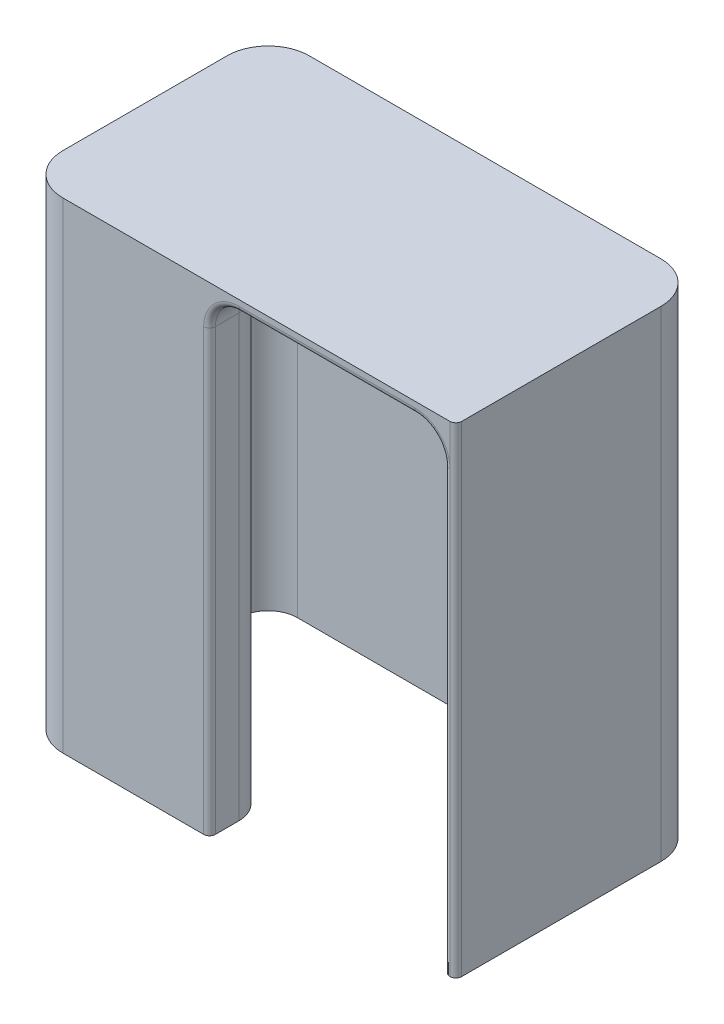
from build123d import *
from OCP.BRepFilletAPI import BRepFilletAPI_MakeChamfer

# Parameters (mm, degrees)
BOSS_EXTRUDE1_DEPTH = 80
SKETCH2_W           = 74
SKETCH2_H           = 42
BOSS_EXTRUDE2_DEPTH = 2
FILLET1_R           = 5
FILLET2_R           = 7
FILLET3_R           = 5
FILLET5_R           = 1
SKETCH3_R           = 1
BOSS_EXTRUDE4_DEPTH = 0.5
CHAMFER1_SIZE       = 0.288675135
CHAMFER1_SIZE_2     = 0.5


with BuildPart() as part:
    # Sketch1 → Boss-Extrude1 (new body)
    with BuildSketch(Plane(origin=(0, 0, 0), x_dir=(1, 0, 0), z_dir=(0, 1, 0))):
        Polygon((0, 0), (74, 0), (74, -42), (72, -42), (72, -2), (2, -2), (2, -32), (32, -32), (32, -42), (0, -42), align=None)
    extrude(amount=BOSS_EXTRUDE1_DEPTH)

    # Sketch2 → Boss-Extrude2 (add)
    with BuildSketch(Plane(origin=(0, 80, 0), x_dir=(1, 0, 0), z_dir=(0, 1, 0))):
        with Locations((37, -21)):
            Rectangle(SKETCH2_W, SKETCH2_H)
    extrude(amount=BOSS_EXTRUDE2_DEPTH)

    # Fillet1
    fillet1_edges = [part.edges().sort_by_distance(p)[0] for p in [
        (72, 40, 2),
        (2, 40, 2),
        (2, 40, 32),
        (32, 40, 32),
    ]]
    fillet(fillet1_edges, radius=FILLET1_R)

    # Fillet2
    fillet2_edges = [part.edges().sort_by_distance(p)[0] for p in [
        (0, 41, 0),
        (74, 41, 0),
        (0, 41, 42),
    ]]
    fillet(fillet2_edges, radius=FILLET2_R)

    # Fillet3
    fillet3_edges = [part.edges().sort_by_distance(p)[0] for p in [
        (32, 80, 39.5),
        (17, 80, 32),
        (2, 80, 17),
        (37, 80, 2),
        (72, 80, 24.5),
        (3.464466094, 80, 3.464466094),
        (70.535533906, 80, 3.464466094),
        (3.464466094, 80, 30.535533906),
        (30.535533906, 80, 33.464466094),
    ]]
    fillet(fillet3_edges, radius=FILLET3_R)

    # Fillet5
    fillet5_edges = [part.edges().sort_by_distance(p)[0] for p in [
        (70.535533906, 78.535533906, 42),
        (74, 41, 42),
        (52, 80, 42),
        (32, 37.5, 42),
        (72, 37.5, 42),
        (33.464466094, 78.535533906, 42),
    ]]
    fillet(fillet5_edges, radius=FILLET5_R - 0.0001)  # a hair under: the kernel refuses the full size

    # Sketch3 → Boss-Extrude4 (add)
    with BuildSketch(Plane(origin=(0, 0, 32), x_dir=(-1, 0, 0), z_dir=(0, 0, -1))):
        with Locations(Location((-12, 72.5, 0), (0, 0, 180))):
            Circle(SKETCH3_R)
        with Locations(Location((-12, 67.5, 0), (0, 0, 180))):
            Circle(SKETCH3_R)
        with Locations(Location((-12, 60.5, 0), (0, 0, 180))):
            Circle(SKETCH3_R)
        with Locations(Location((-12, 48.5, 0), (0, 0, 180))):
            Circle(SKETCH3_R)
        with Locations(Location((-17, 43.5, 0), (0, 0, 180))):
            Circle(SKETCH3_R)
        with Locations(Location((-17, 48.5, 0), (0, 0, 180))):
            Circle(SKETCH3_R)
        with Locations(Location((-22, 48.5, 0), (0, 0, 180))):
            Circle(SKETCH3_R)
        with Locations(Location((-12, 36.5, 0), (0, 0, 180))):
            Circle(SKETCH3_R)
        with Locations(Location((-17, 31.5, 0), (0, 0, 180))):
            Circle(SKETCH3_R)
        with Locations(Location((-22, 36.5, 0), (0, 0, 180))):
            Circle(SKETCH3_R)
        with Locations(Location((-12, 24.5, 0), (0, 0, 180))):
            Circle(SKETCH3_R)
        with Locations(Location((-17, 24.5, 0), (0, 0, 180))):
            Circle(SKETCH3_R)
        with Locations(Location((-22, 24.5, 0), (0, 0, 180))):
            Circle(SKETCH3_R)
        with Locations(Location((-22, 12.5, 0), (0, 0, 180))):
            Circle(SKETCH3_R)
        with Locations(Location((-17, 12.5, 0), (0, 0, 180))):
            Circle(SKETCH3_R)
        with Locations(Location((-12, 7.5, 0), (0, 0, 180))):
            Circle(SKETCH3_R)
    extrude(amount=BOSS_EXTRUDE4_DEPTH)

    # Chamfer1
    chamfer1_edges_1 = [part.edges().sort_by_distance(p)[0] for p in [
        (11, 67.5, 32),
    ]]
    chamfer1_side_1 = [part.faces().sort_by_distance(p)[0] for p in [
        (10.994226497, 67.5, 32),
    ]]
    chamfer1_edges_2 = [part.edges().sort_by_distance(p)[0] for p in [
        (11, 60.5, 32),
    ]]
    chamfer1_side_2 = [part.faces().sort_by_distance(p)[0] for p in [
        (10.994226497, 60.5, 32),
    ]]
    chamfer1_edges_3 = [part.edges().sort_by_distance(p)[0] for p in [
        (11, 48.5, 32),
    ]]
    chamfer1_side_3 = [part.faces().sort_by_distance(p)[0] for p in [
        (10.994226497, 48.5, 32),
    ]]
    chamfer1_edges_4 = [part.edges().sort_by_distance(p)[0] for p in [
        (11, 72.5, 32),
    ]]
    chamfer1_side_4 = [part.faces().sort_by_distance(p)[0] for p in [
        (10.994226497, 72.5, 32),
    ]]
    chamfer1_edges_5 = [part.edges().sort_by_distance(p)[0] for p in [
        (16, 43.5, 32),
    ]]
    chamfer1_side_5 = [part.faces().sort_by_distance(p)[0] for p in [
        (15.994226497, 43.5, 32),
    ]]
    chamfer1_edges_6 = [part.edges().sort_by_distance(p)[0] for p in [
        (16, 48.5, 32),
    ]]
    chamfer1_side_6 = [part.faces().sort_by_distance(p)[0] for p in [
        (15.994226497, 48.5, 32),
    ]]
    chamfer1_edges_7 = [part.edges().sort_by_distance(p)[0] for p in [
        (21, 48.5, 32),
    ]]
    chamfer1_side_7 = [part.faces().sort_by_distance(p)[0] for p in [
        (20.994226497, 48.5, 32),
    ]]
    chamfer1_edges_8 = [part.edges().sort_by_distance(p)[0] for p in [
        (11, 36.5, 32),
    ]]
    chamfer1_side_8 = [part.faces().sort_by_distance(p)[0] for p in [
        (10.994226497, 36.5, 32),
    ]]
    chamfer1_edges_9 = [part.edges().sort_by_distance(p)[0] for p in [
        (16, 31.5, 32),
    ]]
    chamfer1_side_9 = [part.faces().sort_by_distance(p)[0] for p in [
        (15.994226497, 31.5, 32),
    ]]
    chamfer1_edges_10 = [part.edges().sort_by_distance(p)[0] for p in [
        (21, 36.5, 32),
    ]]
    chamfer1_side_10 = [part.faces().sort_by_distance(p)[0] for p in [
        (20.994226497, 36.5, 32),
    ]]
    chamfer1_edges_11 = [part.edges().sort_by_distance(p)[0] for p in [
        (11, 24.5, 32),
    ]]
    chamfer1_side_11 = [part.faces().sort_by_distance(p)[0] for p in [
        (10.994226497, 24.5, 32),
    ]]
    chamfer1_edges_12 = [part.edges().sort_by_distance(p)[0] for p in [
        (16, 24.5, 32),
    ]]
    chamfer1_side_12 = [part.faces().sort_by_distance(p)[0] for p in [
        (15.994226497, 24.5, 32),
    ]]
    chamfer1_edges_13 = [part.edges().sort_by_distance(p)[0] for p in [
        (21, 24.5, 32),
    ]]
    chamfer1_side_13 = [part.faces().sort_by_distance(p)[0] for p in [
        (20.994226497, 24.5, 32),
    ]]
    chamfer1_edges_14 = [part.edges().sort_by_distance(p)[0] for p in [
        (21, 12.5, 32),
    ]]
    chamfer1_side_14 = [part.faces().sort_by_distance(p)[0] for p in [
        (20.994226497, 12.5, 32),
    ]]
    chamfer1_edges_15 = [part.edges().sort_by_distance(p)[0] for p in [
        (16, 12.5, 32),
    ]]
    chamfer1_side_15 = [part.faces().sort_by_distance(p)[0] for p in [
        (15.994226497, 12.5, 32),
    ]]
    chamfer1_edges_16 = [part.edges().sort_by_distance(p)[0] for p in [
        (11, 7.5, 32),
    ]]
    chamfer1_side_16 = [part.faces().sort_by_distance(p)[0] for p in [
        (10.994226497, 7.5, 32),
    ]]
    chamfer1 = BRepFilletAPI_MakeChamfer(part.part.solid().wrapped)
    for e in chamfer1_edges_1:
        chamfer1.Add(CHAMFER1_SIZE - 0.0001, CHAMFER1_SIZE_2 - 0.0001, e.wrapped, chamfer1_side_1[0].wrapped)
    for e in chamfer1_edges_2:
        chamfer1.Add(CHAMFER1_SIZE - 0.0001, CHAMFER1_SIZE_2 - 0.0001, e.wrapped, chamfer1_side_2[0].wrapped)
    for e in chamfer1_edges_3:
        chamfer1.Add(CHAMFER1_SIZE - 0.0001, CHAMFER1_SIZE_2 - 0.0001, e.wrapped, chamfer1_side_3[0].wrapped)
    for e in chamfer1_edges_4:
        chamfer1.Add(CHAMFER1_SIZE - 0.0001, CHAMFER1_SIZE_2 - 0.0001, e.wrapped, chamfer1_side_4[0].wrapped)
    for e in chamfer1_edges_5:
        chamfer1.Add(CHAMFER1_SIZE - 0.0001, CHAMFER1_SIZE_2 - 0.0001, e.wrapped, chamfer1_side_5[0].wrapped)
    for e in chamfer1_edges_6:
        chamfer1.Add(CHAMFER1_SIZE - 0.0001, CHAMFER1_SIZE_2 - 0.0001, e.wrapped, chamfer1_side_6[0].wrapped)
    for e in chamfer1_edges_7:
        chamfer1.Add(CHAMFER1_SIZE - 0.0001, CHAMFER1_SIZE_2 - 0.0001, e.wrapped, chamfer1_side_7[0].wrapped)
    for e in chamfer1_edges_8:
        chamfer1.Add(CHAMFER1_SIZE - 0.0001, CHAMFER1_SIZE_2 - 0.0001, e.wrapped, chamfer1_side_8[0].wrapped)
    for e in chamfer1_edges_9:
        chamfer1.Add(CHAMFER1_SIZE - 0.0001, CHAMFER1_SIZE_2 - 0.0001, e.wrapped, chamfer1_side_9[0].wrapped)
    for e in chamfer1_edges_10:
        chamfer1.Add(CHAMFER1_SIZE - 0.0001, CHAMFER1_SIZE_2 - 0.0001, e.wrapped, chamfer1_side_10[0].wrapped)
    for e in chamfer1_edges_11:
        chamfer1.Add(CHAMFER1_SIZE - 0.0001, CHAMFER1_SIZE_2 - 0.0001, e.wrapped, chamfer1_side_11[0].wrapped)
    for e in chamfer1_edges_12:
        chamfer1.Add(CHAMFER1_SIZE - 0.0001, CHAMFER1_SIZE_2 - 0.0001, e.wrapped, chamfer1_side_12[0].wrapped)
    for e in chamfer1_edges_13:
        chamfer1.Add(CHAMFER1_SIZE - 0.0001, CHAMFER1_SIZE_2 - 0.0001, e.wrapped, chamfer1_side_13[0].wrapped)
    for e in chamfer1_edges_14:
        chamfer1.Add(CHAMFER1_SIZE - 0.0001, CHAMFER1_SIZE_2 - 0.0001, e.wrapped, chamfer1_side_14[0].wrapped)
    for e in chamfer1_edges_15:
        chamfer1.Add(CHAMFER1_SIZE - 0.0001, CHAMFER1_SIZE_2 - 0.0001, e.wrapped, chamfer1_side_15[0].wrapped)
    for e in chamfer1_edges_16:
        chamfer1.Add(CHAMFER1_SIZE - 0.0001, CHAMFER1_SIZE_2 - 0.0001, e.wrapped, chamfer1_side_16[0].wrapped)
    add(Compound.cast(chamfer1.Shape()), mode=Mode.REPLACE)  # a hair under: the kernel refuses the full size


solid = part.part
